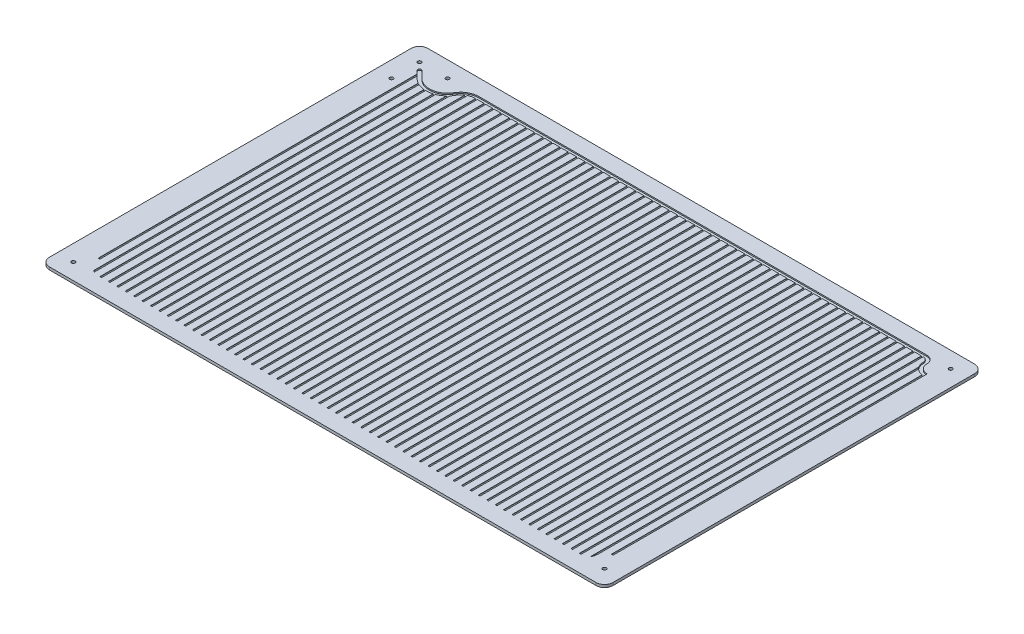
from build123d import *

# Parameters (mm, degrees)
SKETCH1_W                   = 70
SKETCH1_H                   = 450.00000000000006
SKETCH1_W_2                 = 600
BOSS_EXTRUDE1_DEPTH         = 3.2
CUT_EXTRUDE1_DEPTH          = 1.5
TAP_DRILL_FOR_M5X0_8_TAP2_D = 4.2
CUT_EXTRUDE2_START          = -20
CUT_EXTRUDE2_DEPTH          = 410
BOSS_EXTRUDE2_START         = -1.500004
BOSS_EXTRUDE2_DEPTH         = 1.500004
CUT_EXTRUDE3_REACH          = 624.122
SKETCH13_W                  = 3.999999999999943
SKETCH13_H                  = 1.5
CUT_EXTRUDE4_START          = -1.500012
CUT_EXTRUDE4_DEPTH          = 1.500012
FILLET1_R                   = 10
SKETCH15_W                  = 117.30769230769224
SKETCH15_H                  = 74.99999999999996
SKETCH15_H_2                = 74.99999999999999
SKETCH15_W_2                = 117.30769230769243
SKETCH15_H_3                = 75.00000000000001
BOSS_EXTRUDE3_DEPTH         = 10
CUT_EXTRUDE5_DEPTH          = 75
CUT_EXTRUDE6_DEPTH          = 117.307692308
CUT_EXTRUDE7_DEPTH          = 75
CUT_EXTRUDE8_DEPTH          = 117.307692308


with BuildPart() as part:
    # Sketch1 → Boss-Extrude1 (new body)
    with BuildSketch(Plane(origin=(0, 0, 0), x_dir=(1, 0, 0), z_dir=(0, 1, 0))):
        with Locations((-335, 0)):
            Rectangle(SKETCH1_W, SKETCH1_H)
        Rectangle(SKETCH1_W_2, SKETCH1_H)
    extrude(amount=BOSS_EXTRUDE1_DEPTH)

    # Sketch6 → Cut-Extrude1 (cut)
    with BuildSketch(Plane(origin=(0, 3.2, 0), x_dir=(1, 0, 0), z_dir=(0, 1, 0))):
        with BuildLine():
            Line((-341.0606607198741, 198.88908788608498), (-332.72792341334934, 190.55635017763316))
            ThreePointArc((-332.72792341334934, 190.55635017763316), (-314.6907946153867, 184.41974360061323), (-298.8274716885969, 194.97203914593416))
            ThreePointArc((-298.8274716885969, 194.97203914593416), (-290.8614378179462, 202.90529640578592), (-280, 205.8076118445749))
            Line((-280, 205.8076118445749), (-280, 201.80761184457492))
            ThreePointArc((-280, 201.80761184457492), (-288.8662005611003, 199.43844938163073), (-295.368880515407, 192.9625250014872))
            ThreePointArc((-295.368880515407, 192.9625250014872), (-314.17414071780195, 180.4532503445859), (-335.5563506063097, 187.7279231211012))
            Line((-335.5563506063097, 187.7279231211012), (-343.8890879128344, 196.06066082955292))
            ThreePointArc((-343.8890879128344, 196.06066082955292), (-343.8890878446203, 198.88908795429913), (-341.0606607198741, 198.88908788608498))
        make_face()
    extrude(amount=-CUT_EXTRUDE1_DEPTH, mode=Mode.SUBTRACT)

    # Tap Drill for M5x0.8 Tap2 (through all)
    with Locations(Plane(origin=(-350.807611845, 3.2, 205.807611845), x_dir=(0, 0, 1), z_dir=(0, 1, 0))):
        with Locations((0, 0), (-411.61522369, 0), (-411.615222525, 33.33094967), (-378.284274463, 0), (-411.61522369, 631.61522369), (0, 631.61522369)):
            Hole(TAP_DRILL_FOR_M5X0_8_TAP2_D / 2)

    # Sketch11 → Cut-Extrude2 (cut)
    with BuildSketch(Plane.XY.offset(225.00000000000003).offset(CUT_EXTRUDE2_START)):
        with BuildLine():
            Line((-280, 3.2), (-280, 2.7))
            ThreePointArc((-280, 2.7), (-279, 1.7000000000000002), (-278, 2.7))
            Line((-278, 2.7), (-278, 3.2))
            Line((-278, 3.2), (-280, 3.2))
        make_face()
        with BuildLine():
            Line((-270, 3.2), (-270, 2.7))
            ThreePointArc((-270, 2.7), (-269, 1.7000000000000002), (-268, 2.7))
            Line((-268, 2.7), (-268, 3.2))
            Line((-268, 3.2), (-270, 3.2))
        make_face()
        with BuildLine():
            Line((-260, 3.2), (-260, 2.7))
            ThreePointArc((-260, 2.7), (-259, 1.7000000000000002), (-258, 2.7))
            Line((-258, 2.7), (-258, 3.2))
            Line((-258, 3.2), (-260, 3.2))
        make_face()
        with BuildLine():
            Line((-250, 3.2), (-250, 2.7))
            ThreePointArc((-250, 2.7), (-249, 1.7000000000000002), (-248, 2.7))
            Line((-248, 2.7), (-248, 3.2))
            Line((-248, 3.2), (-250, 3.2))
        make_face()
        with BuildLine():
            Line((-240, 3.2), (-240, 2.7))
            ThreePointArc((-240, 2.7), (-239, 1.7000000000000002), (-238, 2.7))
            Line((-238, 2.7), (-238, 3.2))
            Line((-238, 3.2), (-240, 3.2))
        make_face()
        with BuildLine():
            Line((-229.99999999999997, 3.2), (-229.99999999999997, 2.7))
            ThreePointArc((-229.99999999999997, 2.7), (-228.99999999999997, 1.7000000000000002), (-227.99999999999997, 2.7))
            Line((-227.99999999999997, 2.7), (-227.99999999999997, 3.2))
            Line((-227.99999999999997, 3.2), (-229.99999999999997, 3.2))
        make_face()
        with BuildLine():
            Line((-219.99999999999997, 3.2), (-219.99999999999997, 2.7))
            ThreePointArc((-219.99999999999997, 2.7), (-218.99999999999997, 1.7000000000000002), (-217.99999999999997, 2.7))
            Line((-217.99999999999997, 2.7), (-217.99999999999997, 3.2))
            Line((-217.99999999999997, 3.2), (-219.99999999999997, 3.2))
        make_face()
        with BuildLine():
            Line((-209.99999999999997, 3.2), (-209.99999999999997, 2.7))
            ThreePointArc((-209.99999999999997, 2.7), (-208.99999999999997, 1.7000000000000002), (-207.99999999999997, 2.7))
            Line((-207.99999999999997, 2.7), (-207.99999999999997, 3.2))
            Line((-207.99999999999997, 3.2), (-209.99999999999997, 3.2))
        make_face()
        with BuildLine():
            Line((-199.99999999999994, 3.2), (-199.99999999999994, 2.7))
            ThreePointArc((-199.99999999999994, 2.7), (-198.99999999999994, 1.7000000000000002), (-197.99999999999994, 2.7))
            Line((-197.99999999999994, 2.7), (-197.99999999999994, 3.2))
            Line((-197.99999999999994, 3.2), (-199.99999999999994, 3.2))
        make_face()
        with BuildLine():
            Line((-189.99999999999994, 3.2), (-189.99999999999994, 2.7))
            ThreePointArc((-189.99999999999994, 2.7), (-188.99999999999994, 1.7000000000000002), (-187.99999999999994, 2.7))
            Line((-187.99999999999994, 2.7), (-187.99999999999994, 3.2))
            Line((-187.99999999999994, 3.2), (-189.99999999999994, 3.2))
        make_face()
        with BuildLine():
            Line((-179.99999999999994, 3.2), (-179.99999999999994, 2.7))
            ThreePointArc((-179.99999999999994, 2.7), (-178.99999999999994, 1.7000000000000002), (-177.99999999999994, 2.7))
            Line((-177.99999999999994, 2.7), (-177.99999999999994, 3.2))
            Line((-177.99999999999994, 3.2), (-179.99999999999994, 3.2))
        make_face()
        with BuildLine():
            Line((-169.99999999999994, 3.2), (-169.99999999999994, 2.7))
            ThreePointArc((-169.99999999999994, 2.7), (-168.99999999999991, 1.6999999999999718), (-167.99999999999991, 2.7))
            Line((-167.99999999999991, 2.7), (-167.99999999999991, 3.2))
            Line((-167.99999999999991, 3.2), (-169.99999999999994, 3.2))
        make_face()
        with BuildLine():
            Line((-159.99999999999991, 3.2), (-159.99999999999991, 2.7))
            ThreePointArc((-159.99999999999991, 2.7), (-158.99999999999991, 1.7000000000000002), (-157.99999999999991, 2.7))
            Line((-157.99999999999991, 2.7), (-157.99999999999991, 3.2))
            Line((-157.99999999999991, 3.2), (-159.99999999999991, 3.2))
        make_face()
        with BuildLine():
            Line((-149.99999999999991, 3.2), (-149.99999999999991, 2.7))
            ThreePointArc((-149.99999999999991, 2.7), (-148.99999999999991, 1.7000000000000002), (-147.99999999999991, 2.7))
            Line((-147.99999999999991, 2.7), (-147.99999999999991, 3.2))
            Line((-147.99999999999991, 3.2), (-149.99999999999991, 3.2))
        make_face()
        with BuildLine():
            Line((-139.99999999999991, 3.2), (-139.99999999999991, 2.7))
            ThreePointArc((-139.99999999999991, 2.7), (-138.99999999999991, 1.7000000000000002), (-137.9999999999999, 2.7))
            Line((-137.9999999999999, 2.7), (-137.9999999999999, 3.2))
            Line((-137.9999999999999, 3.2), (-139.99999999999991, 3.2))
        make_face()
        with BuildLine():
            Line((-129.9999999999999, 3.2), (-129.9999999999999, 2.7))
            ThreePointArc((-129.9999999999999, 2.7), (-128.9999999999999, 1.7000000000000002), (-127.99999999999989, 2.7))
            Line((-127.99999999999989, 2.7), (-127.99999999999989, 3.2))
            Line((-127.99999999999989, 3.2), (-129.9999999999999, 3.2))
        make_face()
        with BuildLine():
            Line((-119.99999999999989, 3.2), (-119.99999999999989, 2.7))
            ThreePointArc((-119.99999999999989, 2.7), (-118.99999999999989, 1.7000000000000002), (-117.99999999999989, 2.7))
            Line((-117.99999999999989, 2.7), (-117.99999999999989, 3.2))
            Line((-117.99999999999989, 3.2), (-119.99999999999989, 3.2))
        make_face()
        with BuildLine():
            Line((-109.99999999999987, 3.2), (-109.99999999999987, 2.7))
            ThreePointArc((-109.99999999999987, 2.7), (-108.99999999999987, 1.7000000000000002), (-107.99999999999987, 2.7))
            Line((-107.99999999999987, 2.7), (-107.99999999999987, 3.2))
            Line((-107.99999999999987, 3.2), (-109.99999999999987, 3.2))
        make_face()
        with BuildLine():
            Line((-99.99999999999987, 3.2), (-99.99999999999987, 2.7))
            ThreePointArc((-99.99999999999987, 2.7), (-98.99999999999987, 1.7000000000000002), (-97.99999999999986, 2.7))
            Line((-97.99999999999986, 2.7), (-97.99999999999986, 3.2))
            Line((-97.99999999999986, 3.2), (-99.99999999999987, 3.2))
        make_face()
        with BuildLine():
            Line((-89.99999999999986, 3.2), (-89.99999999999986, 2.7))
            ThreePointArc((-89.99999999999986, 2.7), (-88.99999999999986, 1.7000000000000002), (-87.99999999999986, 2.7))
            Line((-87.99999999999986, 2.7), (-87.99999999999986, 3.2))
            Line((-87.99999999999986, 3.2), (-89.99999999999986, 3.2))
        make_face()
        with BuildLine():
            Line((-79.99999999999984, 3.2), (-79.99999999999984, 2.7))
            ThreePointArc((-79.99999999999984, 2.7), (-78.99999999999984, 1.7000000000000002), (-77.99999999999984, 2.7))
            Line((-77.99999999999984, 2.7), (-77.99999999999984, 3.2))
            Line((-77.99999999999984, 3.2), (-79.99999999999984, 3.2))
        make_face()
        with BuildLine():
            Line((-69.99999999999984, 3.2), (-69.99999999999984, 2.7))
            ThreePointArc((-69.99999999999984, 2.7), (-68.99999999999984, 1.7000000000000002), (-67.99999999999984, 2.7))
            Line((-67.99999999999984, 2.7), (-67.99999999999984, 3.2))
            Line((-67.99999999999984, 3.2), (-69.99999999999984, 3.2))
        make_face()
        with BuildLine():
            Line((-59.99999999999983, 3.2), (-59.99999999999983, 2.7))
            ThreePointArc((-59.99999999999983, 2.7), (-58.99999999999983, 1.7000000000000002), (-57.99999999999983, 2.7))
            Line((-57.99999999999983, 2.7), (-57.99999999999983, 3.2))
            Line((-57.99999999999983, 3.2), (-59.99999999999983, 3.2))
        make_face()
        with BuildLine():
            Line((-49.99999999999982, 3.2), (-49.99999999999982, 2.7))
            ThreePointArc((-49.99999999999982, 2.7), (-48.99999999999982, 1.7000000000000002), (-47.99999999999982, 2.7))
            Line((-47.99999999999982, 2.7), (-47.99999999999982, 3.2))
            Line((-47.99999999999982, 3.2), (-49.99999999999982, 3.2))
        make_face()
        with BuildLine():
            Line((-39.999999999999815, 3.2), (-39.999999999999815, 2.7))
            ThreePointArc((-39.999999999999815, 2.7), (-38.999999999999815, 1.7000000000000002), (-37.999999999999815, 2.7))
            Line((-37.999999999999815, 2.7), (-37.999999999999815, 3.2))
            Line((-37.999999999999815, 3.2), (-39.999999999999815, 3.2))
        make_face()
        with BuildLine():
            Line((-29.999999999999805, 3.2), (-29.999999999999805, 2.7))
            ThreePointArc((-29.999999999999805, 2.7), (-28.999999999999805, 1.7000000000000002), (-27.9999999999998, 2.7))
            Line((-27.9999999999998, 2.7), (-27.9999999999998, 3.2))
            Line((-27.9999999999998, 3.2), (-29.999999999999805, 3.2))
        make_face()
        with BuildLine():
            Line((-19.999999999999794, 3.2), (-19.999999999999794, 2.7))
            ThreePointArc((-19.999999999999794, 2.7), (-18.999999999999794, 1.7000000000000002), (-17.999999999999794, 2.7))
            Line((-17.999999999999794, 2.7), (-17.999999999999794, 3.2))
            Line((-17.999999999999794, 3.2), (-19.999999999999794, 3.2))
        make_face()
        with BuildLine():
            Line((-9.999999999999787, 3.2), (-9.999999999999787, 2.7))
            ThreePointArc((-9.999999999999787, 2.7), (-8.999999999999787, 1.7000000000000002), (-7.999999999999785, 2.7))
            Line((-7.999999999999785, 2.7), (-7.999999999999785, 3.2))
            Line((-7.999999999999785, 3.2), (-9.999999999999787, 3.2))
        make_face()
        with BuildLine():
            Line((2.2204e-13, 3.2), (2.2204e-13, 2.7))
            ThreePointArc((2.2204e-13, 2.7), (1.0000000000002227, 1.6999999999999993), (2.000000000000224, 2.7))
            Line((2.000000000000224, 2.7), (2.000000000000224, 3.2))
            Line((2.000000000000224, 3.2), (2.2204e-13, 3.2))
        make_face()
        with BuildLine():
            Line((10.000000000000231, 3.2), (10.000000000000231, 2.7))
            ThreePointArc((10.000000000000231, 2.7), (11.000000000000231, 1.7000000000000002), (12.000000000000233, 2.7))
            Line((12.000000000000233, 2.7), (12.000000000000233, 3.2))
            Line((12.000000000000233, 3.2), (10.000000000000231, 3.2))
        make_face()
        with BuildLine():
            Line((20.00000000000024, 3.2), (20.00000000000024, 2.7))
            ThreePointArc((20.00000000000024, 2.7), (21.00000000000024, 1.7000000000000002), (22.00000000000024, 2.7))
            Line((22.00000000000024, 2.7), (22.00000000000024, 3.2))
            Line((22.00000000000024, 3.2), (20.00000000000024, 3.2))
        make_face()
        with BuildLine():
            Line((30.00000000000025, 3.2), (30.00000000000025, 2.7))
            ThreePointArc((30.00000000000025, 2.7), (31.00000000000025, 1.7000000000000002), (32.00000000000025, 2.7))
            Line((32.00000000000025, 2.7), (32.00000000000025, 3.2))
            Line((32.00000000000025, 3.2), (30.00000000000025, 3.2))
        make_face()
        with BuildLine():
            Line((40.000000000000256, 3.2), (40.000000000000256, 2.7))
            ThreePointArc((40.000000000000256, 2.7), (41.000000000000256, 1.7000000000000002), (42.000000000000256, 2.7))
            Line((42.000000000000256, 2.7), (42.000000000000256, 3.2))
            Line((42.000000000000256, 3.2), (40.000000000000256, 3.2))
        make_face()
        with BuildLine():
            Line((50.00000000000027, 3.2), (50.00000000000027, 2.7))
            ThreePointArc((50.00000000000027, 2.7), (51.00000000000027, 1.7000000000000002), (52.00000000000027, 2.7))
            Line((52.00000000000027, 2.7), (52.00000000000027, 3.2))
            Line((52.00000000000027, 3.2), (50.00000000000027, 3.2))
        make_face()
        with BuildLine():
            Line((60.00000000000028, 3.2), (60.00000000000028, 2.7))
            ThreePointArc((60.00000000000028, 2.7), (61.00000000000028, 1.7000000000000002), (62.00000000000028, 2.7))
            Line((62.00000000000028, 2.7), (62.00000000000028, 3.2))
            Line((62.00000000000028, 3.2), (60.00000000000028, 3.2))
        make_face()
        with BuildLine():
            Line((70.00000000000028, 3.2), (70.00000000000028, 2.7))
            ThreePointArc((70.00000000000028, 2.7), (71.00000000000028, 1.7000000000000002), (72.00000000000028, 2.7))
            Line((72.00000000000028, 2.7), (72.00000000000028, 3.2))
            Line((72.00000000000028, 3.2), (70.00000000000028, 3.2))
        make_face()
        with BuildLine():
            Line((80.0000000000003, 3.2), (80.0000000000003, 2.7))
            ThreePointArc((80.0000000000003, 2.7), (81.0000000000003, 1.7000000000000002), (82.0000000000003, 2.7))
            Line((82.0000000000003, 2.7), (82.0000000000003, 3.2))
            Line((82.0000000000003, 3.2), (80.0000000000003, 3.2))
        make_face()
        with BuildLine():
            Line((90.0000000000003, 3.2), (90.0000000000003, 2.7))
            ThreePointArc((90.0000000000003, 2.7), (91.0000000000003, 1.7000000000000002), (92.0000000000003, 2.7))
            Line((92.0000000000003, 2.7), (92.0000000000003, 3.2))
            Line((92.0000000000003, 3.2), (90.0000000000003, 3.2))
        make_face()
        with BuildLine():
            Line((100.00000000000031, 3.2), (100.00000000000031, 2.7))
            ThreePointArc((100.00000000000031, 2.7), (101.00000000000031, 1.7000000000000002), (102.00000000000031, 2.7))
            Line((102.00000000000031, 2.7), (102.00000000000031, 3.2))
            Line((102.00000000000031, 3.2), (100.00000000000031, 3.2))
        make_face()
        with BuildLine():
            Line((110.00000000000031, 3.2), (110.00000000000031, 2.7))
            ThreePointArc((110.00000000000031, 2.7), (111.00000000000033, 1.699999999999986), (112.00000000000033, 2.7))
            Line((112.00000000000033, 2.7), (112.00000000000033, 3.2))
            Line((112.00000000000033, 3.2), (110.00000000000031, 3.2))
        make_face()
        with BuildLine():
            Line((120.00000000000033, 3.2), (120.00000000000033, 2.7))
            ThreePointArc((120.00000000000033, 2.7), (121.00000000000033, 1.7000000000000002), (122.00000000000033, 2.7))
            Line((122.00000000000033, 2.7), (122.00000000000033, 3.2))
            Line((122.00000000000033, 3.2), (120.00000000000033, 3.2))
        make_face()
        with BuildLine():
            Line((130.00000000000034, 3.2), (130.00000000000034, 2.7))
            ThreePointArc((130.00000000000034, 2.7), (131.00000000000034, 1.7000000000000002), (132.00000000000034, 2.7))
            Line((132.00000000000034, 2.7), (132.00000000000034, 3.2))
            Line((132.00000000000034, 3.2), (130.00000000000034, 3.2))
        make_face()
        with BuildLine():
            Line((140.00000000000034, 3.2), (140.00000000000034, 2.7))
            ThreePointArc((140.00000000000034, 2.7), (141.00000000000034, 1.7000000000000002), (142.00000000000034, 2.7))
            Line((142.00000000000034, 2.7), (142.00000000000034, 3.2))
            Line((142.00000000000034, 3.2), (140.00000000000034, 3.2))
        make_face()
        with BuildLine():
            Line((150.00000000000034, 3.2), (150.00000000000034, 2.7))
            ThreePointArc((150.00000000000034, 2.7), (151.00000000000037, 1.6999999999999718), (152.00000000000037, 2.7))
            Line((152.00000000000037, 2.7), (152.00000000000037, 3.2))
            Line((152.00000000000037, 3.2), (150.00000000000034, 3.2))
        make_face()
        with BuildLine():
            Line((160.00000000000037, 3.2), (160.00000000000037, 2.7))
            ThreePointArc((160.00000000000037, 2.7), (161.00000000000037, 1.7000000000000002), (162.00000000000037, 2.7))
            Line((162.00000000000037, 2.7), (162.00000000000037, 3.2))
            Line((162.00000000000037, 3.2), (160.00000000000037, 3.2))
        make_face()
        with BuildLine():
            Line((170.00000000000037, 3.2), (170.00000000000037, 2.7))
            ThreePointArc((170.00000000000037, 2.7), (171.00000000000037, 1.7000000000000002), (172.00000000000037, 2.7))
            Line((172.00000000000037, 2.7), (172.00000000000037, 3.2))
            Line((172.00000000000037, 3.2), (170.00000000000037, 3.2))
        make_face()
        with BuildLine():
            Line((180.00000000000037, 3.2), (180.00000000000037, 2.7))
            ThreePointArc((180.00000000000037, 2.7), (181.00000000000037, 1.7000000000000002), (182.0000000000004, 2.7))
            Line((182.0000000000004, 2.7), (182.0000000000004, 3.2))
            Line((182.0000000000004, 3.2), (180.00000000000037, 3.2))
        make_face()
        with BuildLine():
            Line((190.0000000000004, 3.2), (190.0000000000004, 2.7))
            ThreePointArc((190.0000000000004, 2.7), (191.0000000000004, 1.7000000000000002), (192.0000000000004, 2.7))
            Line((192.0000000000004, 2.7), (192.0000000000004, 3.2))
            Line((192.0000000000004, 3.2), (190.0000000000004, 3.2))
        make_face()
        with BuildLine():
            Line((200.0000000000004, 3.2), (200.0000000000004, 2.7))
            ThreePointArc((200.0000000000004, 2.7), (201.0000000000004, 1.7000000000000002), (202.0000000000004, 2.7))
            Line((202.0000000000004, 2.7), (202.0000000000004, 3.2))
            Line((202.0000000000004, 3.2), (200.0000000000004, 3.2))
        make_face()
        with BuildLine():
            Line((210.0000000000004, 3.2), (210.0000000000004, 2.7))
            ThreePointArc((210.0000000000004, 2.7), (211.0000000000004, 1.7000000000000002), (212.0000000000004, 2.7))
            Line((212.0000000000004, 2.7), (212.0000000000004, 3.2))
            Line((212.0000000000004, 3.2), (210.0000000000004, 3.2))
        make_face()
        with BuildLine():
            Line((220.00000000000043, 3.2), (220.00000000000043, 2.7))
            ThreePointArc((220.00000000000043, 2.7), (221.00000000000043, 1.7000000000000002), (222.00000000000043, 2.7))
            Line((222.00000000000043, 2.7), (222.00000000000043, 3.2))
            Line((222.00000000000043, 3.2), (220.00000000000043, 3.2))
        make_face()
        with BuildLine():
            Line((230.00000000000043, 3.2), (230.00000000000043, 2.7))
            ThreePointArc((230.00000000000043, 2.7), (231.00000000000043, 1.7000000000000002), (232.00000000000043, 2.7))
            Line((232.00000000000043, 2.7), (232.00000000000043, 3.2))
            Line((232.00000000000043, 3.2), (230.00000000000043, 3.2))
        make_face()
        with BuildLine():
            Line((240.00000000000043, 3.2), (240.00000000000043, 2.7))
            ThreePointArc((240.00000000000043, 2.7), (241.00000000000043, 1.7000000000000002), (242.00000000000043, 2.7))
            Line((242.00000000000043, 2.7), (242.00000000000043, 3.2))
            Line((242.00000000000043, 3.2), (240.00000000000043, 3.2))
        make_face()
        with BuildLine():
            Line((250.00000000000045, 3.2), (250.00000000000045, 2.7))
            ThreePointArc((250.00000000000045, 2.7), (251.00000000000045, 1.7000000000000002), (252.00000000000045, 2.7))
            Line((252.00000000000045, 2.7), (252.00000000000045, 3.2))
            Line((252.00000000000045, 3.2), (250.00000000000045, 3.2))
        make_face()
        with BuildLine():
            Line((260.00000000000045, 3.2), (260.00000000000045, 2.7))
            ThreePointArc((260.00000000000045, 2.7), (261.00000000000045, 1.7000000000000002), (262.00000000000045, 2.7))
            Line((262.00000000000045, 2.7), (262.00000000000045, 3.2))
            Line((262.00000000000045, 3.2), (260.00000000000045, 3.2))
        make_face()
        with BuildLine():
            Line((270.00000000000045, 3.2), (270.00000000000045, 2.7))
            ThreePointArc((270.00000000000045, 2.7), (271.00000000000045, 1.7000000000000002), (272.00000000000045, 2.7))
            Line((272.00000000000045, 2.7), (272.00000000000045, 3.2))
            Line((272.00000000000045, 3.2), (270.00000000000045, 3.2))
        make_face()
        with BuildLine():
            Line((-290.00000000000006, 3.1999999999999305), (-290.00000000000006, 2.6999999999999305))
            ThreePointArc((-290.00000000000006, 2.6999999999999305), (-289.00000000000006, 1.6999999999999305), (-288.00000000000006, 2.6999999999999305))
            Line((-288.00000000000006, 2.6999999999999305), (-288.00000000000006, 3.1999999999999305))
            Line((-288.00000000000006, 3.1999999999999305), (-290.00000000000006, 3.1999999999999305))
        make_face()
        with BuildLine():
            Line((-300.00000000000006, 3.1999999999998603), (-300.00000000000006, 2.6999999999998603))
            ThreePointArc((-300.00000000000006, 2.6999999999998603), (-299.00000000000006, 1.6999999999998603), (-298.00000000000006, 2.6999999999998603))
            Line((-298.00000000000006, 2.6999999999998603), (-298.00000000000006, 3.1999999999998603))
            Line((-298.00000000000006, 3.1999999999998603), (-300.00000000000006, 3.1999999999998603))
        make_face()
        with BuildLine():
            Line((-310.00000000000006, 3.1999999999997906), (-310.00000000000006, 2.6999999999997906))
            ThreePointArc((-310.00000000000006, 2.6999999999997906), (-309.00000000000006, 1.6999999999997906), (-308.00000000000006, 2.6999999999997906))
            Line((-308.00000000000006, 2.6999999999997906), (-308.00000000000006, 3.1999999999997906))
            Line((-308.00000000000006, 3.1999999999997906), (-310.00000000000006, 3.1999999999997906))
        make_face()
        with BuildLine():
            Line((-320.00000000000006, 3.199999999999721), (-320.00000000000006, 2.699999999999721))
            ThreePointArc((-320.00000000000006, 2.699999999999721), (-319.00000000000006, 1.6999999999997208), (-318.00000000000006, 2.699999999999721))
            Line((-318.00000000000006, 2.699999999999721), (-318.00000000000006, 3.199999999999721))
            Line((-318.00000000000006, 3.199999999999721), (-320.00000000000006, 3.199999999999721))
        make_face()
        with BuildLine():
            Line((-330.00000000000006, 3.199999999999651), (-330.00000000000006, 2.699999999999651))
            ThreePointArc((-330.00000000000006, 2.699999999999651), (-329.00000000000006, 1.6999999999996511), (-328.00000000000006, 2.699999999999651))
            Line((-328.00000000000006, 2.699999999999651), (-328.00000000000006, 3.199999999999651))
            Line((-328.00000000000006, 3.199999999999651), (-330.00000000000006, 3.199999999999651))
        make_face()
        with BuildLine():
            Line((-340.00000000000006, 3.1999999999995814), (-340.00000000000006, 2.6999999999995814))
            ThreePointArc((-340.00000000000006, 2.6999999999995814), (-339.00000000000006, 1.6999999999995814), (-338.00000000000006, 2.6999999999995814))
            Line((-338.00000000000006, 2.6999999999995814), (-338.00000000000006, 3.1999999999995814))
            Line((-338.00000000000006, 3.1999999999995814), (-340.00000000000006, 3.1999999999995814))
        make_face()
    extrude(amount=-CUT_EXTRUDE2_DEPTH, mode=Mode.SUBTRACT)

    # Sketch12 → Boss-Extrude2 (add)
    with BuildSketch(Plane(origin=(0, 3.2, 0), x_dir=(1, 0, 0), z_dir=(0, 1, 0)).offset(BOSS_EXTRUDE2_START)):
        with BuildLine():
            Line((-280, 205.8076118445749), (-315.3766621750845, 205.80761184457492))
            ThreePointArc((-315.3766621750845, 205.80761184457492), (-317.4766621750842, 203.70761068025845), (-319.57666217508387, 205.8076118445749))
            Line((-319.57666217508387, 205.8076118445749), (-347.8076118445748, 205.80761184457492))
            ThreePointArc((-347.8076118445748, 205.80761184457492), (-348.68629150101515, 203.6862915010153), (-350.8076118445748, 202.80761184457492))
            Line((-350.8076118445748, 202.80761184457492), (-350.8076118445748, 177.42283645946387))
            ThreePointArc((-350.8076118445748, 177.42283645946387), (-348.1152238035296, 183.9228359616302), (-341.6152241714967, 186.61522368914976))
            ThreePointArc((-341.6152241714967, 186.61522368914976), (-340.80494778100666, 186.64810510087744), (-340, 186.74653317652297))
            Line((-340, 186.74653317652297), (-340, 192.17157272912957))
            Line((-340, 192.17157272912957), (-343.8890879128344, 196.06066082955292))
            ThreePointArc((-343.8890879128344, 196.06066082955292), (-343.8890878446203, 198.88908795429913), (-341.0606607198741, 198.88908788608498))
            Line((-341.0606607198741, 198.88908788608498), (-339.00000000000006, 196.82842706681564))
            Line((-339.00000000000006, 196.82842706681564), (-332.72792341334934, 190.55635017763316))
            ThreePointArc((-332.72792341334934, 190.55635017763316), (-330.94667886073466, 188.9624165061017), (-329.00000000000006, 187.57536996087322))
            ThreePointArc((-329.00000000000006, 187.57536996087322), (-324.20329094233676, 185.3148221510144), (-319.00000000000006, 184.29293294277124))
            ThreePointArc((-319.00000000000006, 184.29293294277124), (-313.8997661604346, 184.53773218560949), (-309.00000000000006, 185.97460499160286))
            ThreePointArc((-309.00000000000006, 185.97460499160286), (-303.3144543819765, 189.5400421249523), (-299.00000000000006, 194.68039759051484))
            ThreePointArc((-299.00000000000006, 194.68039759051484), (-298.9131631067138, 194.82587955008788), (-298.8274716885969, 194.97203914593416))
            ThreePointArc((-298.8274716885969, 194.97203914593416), (-294.6062905919319, 200.1820345928733), (-289.00000000000006, 203.86061151972768))
            ThreePointArc((-289.00000000000006, 203.86061151972768), (-284.6040962811652, 205.31529626056675), (-280, 205.8076118445749))
        make_face()
        with BuildLine():
            Line((-350.8076118445748, -177.42283645946387), (-350.80761184457475, -203.70761184457504))
            ThreePointArc((-350.80761184457475, -203.70761184457504), (-349.322687604083, -204.32268760408328), (-348.7076118445748, -205.80761184457504))
            Line((-348.7076118445748, -205.80761184457504), (-322.42283601607215, -205.80761091883545))
            ThreePointArc((-322.42283601607215, -205.80761091883545), (-328.9228356481046, -203.11522319131578), (-331.6152236891497, -196.61522368914987))
            ThreePointArc((-331.6152236891497, -196.61522368914987), (-334.5441560478196, -189.5441557067489), (-341.6152241714967, -186.61522368914976))
            ThreePointArc((-341.6152241714967, -186.61522368914976), (-348.1152238035296, -183.9228359616302), (-350.8076118445748, -177.42283645946387))
        make_face()
        with BuildLine():
            Line((278.70761184452584, -205.80761184457504), (252.4228360160232, -205.80761091883545))
            ThreePointArc((252.4228360160232, -205.80761091883545), (258.9228356480558, -203.11522319131592), (261.61522368910096, -196.61522368914987))
            ThreePointArc((261.61522368910096, -196.61522368914987), (264.5441560477708, -189.54415570674908), (271.6152241714478, -186.61522368914987))
            ThreePointArc((271.6152241714478, -186.61522368914987), (278.1152238034807, -183.92283596163023), (280.8076118445259, -177.42283645946387))
            Line((280.8076118445259, -177.42283645946387), (280.80761184452587, -203.70761184457504))
            ThreePointArc((280.80761184452587, -203.70761184457504), (279.3226876040341, -204.32268760408328), (278.70761184452584, -205.80761184457504))
        make_face()
        with BuildLine():
            Line((280.8076118445259, 177.42283645946392), (280.80761184452587, 203.7076118445751))
            ThreePointArc((280.80761184452587, 203.7076118445751), (279.3226876040341, 204.32268760408334), (278.70761184452584, 205.8076118445751))
            Line((278.70761184452584, 205.8076118445751), (252.4228360160232, 205.8076109188355))
            ThreePointArc((252.4228360160232, 205.8076109188355), (258.9228356480558, 203.11522319131598), (261.61522368910096, 196.61522368914993))
            ThreePointArc((261.61522368910096, 196.61522368914993), (264.5441560477708, 189.54415570674914), (271.6152241714478, 186.61522368914993))
            ThreePointArc((271.6152241714478, 186.61522368914993), (278.1152238034807, 183.92283596163028), (280.8076118445259, 177.42283645946392))
        make_face()
    extrude(amount=BOSS_EXTRUDE2_DEPTH)

    # Cut-Extrude3: up to this face of the body (flat: up to its plane)
    cut_extrude3_end = Plane(part.part.faces().sort_by_distance((252, 2.95, 0))[0])
    # Sketch13 → Cut-Extrude3 (cut, up to the picked face)
    with BuildSketch(Plane.ZY.offset(280), mode=Mode.PRIVATE) as cut_extrude3_sk1:
        with Locations((-203.8076118445749, 2.45)):
            Rectangle(SKETCH13_W, SKETCH13_H)
    cut_extrude3_tool1 = split(extrude(cut_extrude3_sk1.sketch, amount=-CUT_EXTRUDE3_REACH, mode=Mode.PRIVATE), bisect_by=cut_extrude3_end, keep=Keep.BOTH, mode=Mode.PRIVATE)
    add(cut_extrude3_tool1.solids().sort_by(Axis((-280, 2.45, -203.807612), (1, 0, 0)))[0], mode=Mode.SUBTRACT)

    # Sketch14 → Cut-Extrude4 (cut)
    with BuildSketch(Plane(origin=(0, 3.2, 0), x_dir=(1, 0, 0), z_dir=(0, 1, 0)).offset(CUT_EXTRUDE4_START)):
        with BuildLine():
            Line((252.42283601607218, 205.80761091883545), (252.00000000000045, 205.8076118445749))
            Line((252.00000000000045, 205.8076118445749), (252.00000000000045, 201.80761184457492))
            ThreePointArc((252.00000000000045, 201.80761184457492), (255.9539047554501, 200.44552943636293), (257.63241277890234, 196.61522368914976))
            ThreePointArc((257.63241277890234, 196.61522368914976), (261.72788351292104, 186.7278830360081), (271.6152243636065, 182.63241277890236))
            ThreePointArc((271.6152243636065, 182.63241277890236), (271.8077436848893, 182.6288543076604), (272.00000000000045, 182.61818373669826))
            Line((272.00000000000045, 182.61818373669826), (272.00000000000045, 186.60716718540516))
            ThreePointArc((272.00000000000045, 186.60716718540516), (271.8076542533465, 186.6132093471491), (271.6152241714968, 186.6152236891498))
            ThreePointArc((271.6152241714968, 186.6152236891498), (264.54415604781974, 189.5441557067489), (261.61522368914984, 196.6152236891497))
            ThreePointArc((261.61522368914984, 196.6152236891497), (258.9228356481048, 203.11522319131586), (252.42283601607218, 205.80761091883545))
        make_face()
    extrude(amount=CUT_EXTRUDE4_DEPTH, mode=Mode.SUBTRACT)

    # Fillet1
    fillet1_edges = [part.edges().sort_by_distance(p)[0] for p in [
        (300, 1.6, 225.00000000000003),
        (-370, 1.6, 225.00000000000003),
        (-370, 1.6, -225.00000000000003),
        (300, 1.6, -225.00000000000003),
    ]]
    fillet(fillet1_edges, radius=FILLET1_R)

    # Sketch15 → Boss-Extrude3 (add)
    with BuildSketch(Plane.XZ):
        with Locations((-281.3461538461538, 157.50000000000003)):
            Rectangle(SKETCH15_W, SKETCH15_H)
        with Locations((-281.3461538461538, -157.50000000000006)):
            Rectangle(SKETCH15_W, SKETCH15_H_2)
        Polygon((269.99999999999983, 195.00000000000003), (152.69230769230737, 195.00000000000003), (152.6923076923074, 120.00000000000003), (269.99999999999983, 120.00000000000003), align=None)
        with Locations((211.3461538461536, -157.50000000000006)):
            Rectangle(SKETCH15_W_2, SKETCH15_H_3)
    extrude(amount=BOSS_EXTRUDE3_DEPTH)

    # Sketch16 → Cut-Extrude5 (cut)
    with BuildSketch(Plane.XY.offset(195.00000000000003)):
        Polygon((-332.49999999999994, -9.999999999999998), (-322.4999999999999, 0), (-322.4999999999999, -9.999999999999998), align=None)
        Polygon((-299.9999999999999, -9.999999999999998), (-299.9999999999999, 0), (-309.99999999999994, -9.999999999999998), align=None)
        Polygon((-277.4999999999999, -9.999999999999998), (-277.4999999999999, 0), (-287.49999999999994, -9.999999999999998), align=None)
        Polygon((-254.99999999999983, -9.999999999999998), (-254.99999999999983, 0), (-264.9999999999999, -9.999999999999998), align=None)
        Polygon((-232.49999999999983, -9.999999999999998), (-232.49999999999983, 0), (-242.4999999999999, -9.999999999999998), align=None)
    extrude(amount=-CUT_EXTRUDE5_DEPTH, mode=Mode.SUBTRACT)

    # Sketch17 → Cut-Extrude6 (cut)
    with BuildSketch(Plane.ZY.offset(339.99999999999994)):
        Polygon((-127.50000000000006, 0), (-127.50000000000006, -10), (-137.50000000000006, -10.000000000000004), align=None)
        Polygon((-162.50000000000006, -10.00000000000018), (-152.50000000000006, -1.7457e-13), (-152.50000000000006, -10.000000000000176), align=None)
        Polygon((-187.50000000000006, -10.000000000000352), (-177.50000000000006, -3.4915e-13), (-177.50000000000006, -10.000000000000348), align=None)
    extrude(amount=-CUT_EXTRUDE6_DEPTH, mode=Mode.SUBTRACT)

    # Sketch18 → Cut-Extrude7 (cut)
    with BuildSketch(Plane(origin=(0, 0, -195.00000000000006), x_dir=(-1, 0, 0), z_dir=(0, 0, -1))):
        Polygon((-160.19230769230742, 0), (-160.19230769230742, -10), (-170.19230769230742, -10), align=None)
        Polygon((-182.6923076923074, -1.5712e-13), (-182.6923076923074, -10.000000000000158), (-192.69230769230742, -10.000000000000158), align=None)
        Polygon((-205.1923076923074, -3.1423e-13), (-205.1923076923074, -10.000000000000314), (-215.1923076923074, -10.000000000000314), align=None)
        Polygon((-227.69230769230742, -4.7135e-13), (-227.69230769230742, -10.000000000000473), (-237.69230769230742, -10.000000000000473), align=None)
        Polygon((-250.1923076923074, -6.2847e-13), (-250.1923076923074, -10.000000000000629), (-260.1923076923074, -10.000000000000629), align=None)
    extrude(amount=-CUT_EXTRUDE7_DEPTH, mode=Mode.SUBTRACT)

    # Sketch19 → Cut-Extrude8 (cut)
    with BuildSketch(Plane(origin=(269.99999999999983, 0, 0), x_dir=(0, 0, -1), z_dir=(1, 0, 0))):
        Polygon((-127.50000000000003, 0), (-127.50000000000003, -10), (-137.50000000000003, -10), align=None)
        Polygon((-162.50000000000003, -10.000000000000176), (-152.50000000000003, -1.7457e-13), (-152.50000000000003, -10.000000000000176), align=None)
        Polygon((-187.50000000000006, -10.000000000000348), (-177.50000000000006, -3.4915e-13), (-177.50000000000006, -10.000000000000348), align=None)
    extrude(amount=-CUT_EXTRUDE8_DEPTH, mode=Mode.SUBTRACT)


solid = part.part
